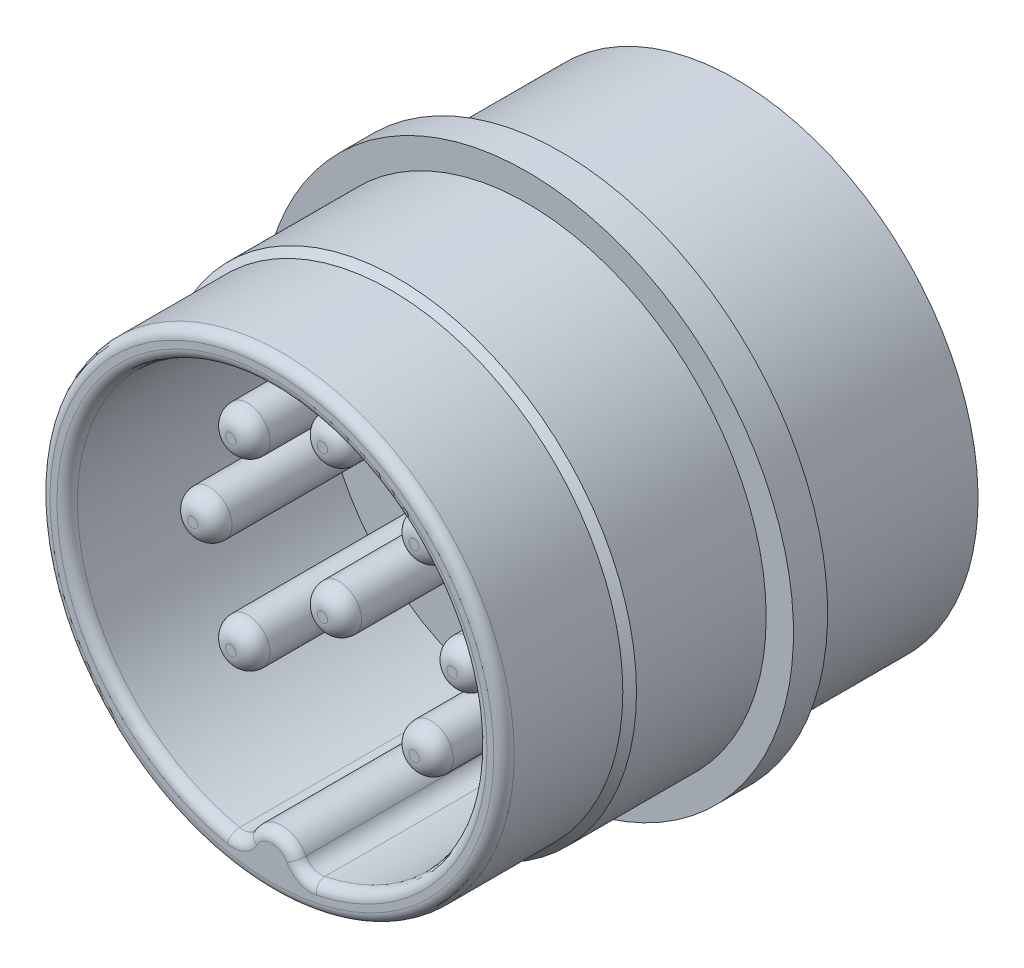
from build123d import *

# Parameters (mm, degrees)
SKETCH1_W           = 9.906
SKETCH1_H           = 1.27
SKETCH2_R           = 9
BOSS_EXTRUDE1_DEPTH = 6.5024
SKETCH3_R           = 8.89
BOSS_EXTRUDE2_DEPTH = 4.826
SKETCH4_R           = 8.89
BOSS_EXTRUDE3_DEPTH = 0.254
BOSS_EXTRUDE3_TAPER = 45
SKETCH5_R           = 8.636
BOSS_EXTRUDE4_DEPTH = 4.4196
CUT_EXTRUDE1_DEPTH  = 9.4996
SKETCH7_W           = 0.8255
SKETCH7_H           = 7.62
SKETCH8_W           = 0.8255
SKETCH8_H           = 7.62
SKETCH9_W           = 0.8255
SKETCH9_H           = 7.62
SKETCH10_W          = 0.8255
SKETCH10_H          = 7.62
SKETCH11_W          = 0.8255
SKETCH11_H          = 7.62
SKETCH12_W          = 0.8255
SKETCH12_H          = 7.62
SKETCH13_W          = 0.8255
SKETCH13_H          = 7.62
SKETCH14_W          = 0.8255
SKETCH14_H          = 7.62
RIB1_START          = -1.27
RIB1_OUTLINE_W      = 2.779
RIB1_OUTLINE_H      = 1.016
RIB1_DEPTH          = 2.54
FILLET1_R           = 0.0254
FILLET2_R           = 0.635
FILLET3_R           = 0.381


# Read off the part's stored shape, not the designer's step: Rib1
with BuildPart() as part:
    # Sketch1 → Revolve1 (revolve)
    with BuildSketch(Plane.XZ, mode=Mode.PRIVATE) as revolve1_sk:
        with Locations((4.953, -0.635)):
            Rectangle(SKETCH1_W, SKETCH1_H)
    revolve(revolve1_sk.sketch.rotate(Axis((0, 0, 0), (0, 0, -1)), 180), axis=Axis((0, 0, 0), (0, 0, -1)))

    # Sketch2 → Boss-Extrude1 (add)
    with BuildSketch(Plane(origin=(0, 0, -1.27), x_dir=(-1, 0, 0), z_dir=(0, 0, -1))):
        Circle(SKETCH2_R)
    extrude(amount=BOSS_EXTRUDE1_DEPTH)

    # Sketch3 → Boss-Extrude2 (add)
    with BuildSketch(Plane.XY):
        Circle(SKETCH3_R)
    extrude(amount=BOSS_EXTRUDE2_DEPTH)

    # Sketch4 → Boss-Extrude3 (add)
    with BuildSketch(Plane.XY.offset(4.826)):
        Circle(SKETCH4_R)
    extrude(amount=BOSS_EXTRUDE3_DEPTH, taper=BOSS_EXTRUDE3_TAPER)

    # Sketch5 → Boss-Extrude4 (add)
    with BuildSketch(Plane.XY.offset(5.08)):
        Circle(SKETCH5_R)
    extrude(amount=BOSS_EXTRUDE4_DEPTH)

    # Sketch6 → Cut-Extrude1 (cut)
    with BuildSketch(Plane.XY.offset(9.4996)):
        with BuildLine():
            ThreePointArc((-1.013739708, -7.552266667), (0, -6.604), (1.013739708, -7.552266667))
            ThreePointArc((1.013739708, -7.552266667), (0, 7.62), (-1.013739708, -7.552266667))
        make_face()
    extrude(amount=-CUT_EXTRUDE1_DEPTH, mode=Mode.SUBTRACT)

    # Sketch7 → Revolve2 (revolve)
    with BuildSketch(Plane(origin=(0, 0, 0), x_dir=(1, 0, 0), z_dir=(0, 1, 0))):
        with Locations((-4.41325, -3.81)):
            Rectangle(SKETCH7_W, SKETCH7_H)
    revolve(axis=Axis((-4.826, 0, 0), (0, 0, 1)))

    # Sketch8 → Revolve3 (revolve)
    with BuildSketch(Plane(origin=(0, 3.412497326, 0), x_dir=(1, 0, 0), z_dir=(0, 1, 0))):
        with Locations((-2.999747326, -3.81)):
            Rectangle(SKETCH8_W, SKETCH8_H)
    revolve(axis=Axis((-3.412497326, 3.412497326, 0), (0, 0, 1)))

    # Sketch9 → Revolve4 (revolve)
    with BuildSketch(Plane(origin=(0, -3.412497326, 0), x_dir=(1, 0, 0), z_dir=(0, 1, 0))):
        with Locations((-2.999747326, -3.81)):
            Rectangle(SKETCH9_W, SKETCH9_H)
    revolve(axis=Axis((-3.412497326, -3.412497326, 0), (0, 0, 1)))

    # Sketch10 → Revolve5 (revolve)
    with BuildSketch(Plane(origin=(0, -3.412497326, 0), x_dir=(1, 0, 0), z_dir=(0, 1, 0))):
        with Locations((3.825247326, -3.81)):
            Rectangle(SKETCH10_W, SKETCH10_H)
    revolve(axis=Axis((3.412497326, -3.412497326, 0), (0, 0, 1)))

    # Sketch11 → Revolve6 (revolve)
    with BuildSketch(Plane(origin=(0, 0, 0), x_dir=(1, 0, 0), z_dir=(0, 1, 0))):
        with Locations((5.23875, -3.81)):
            Rectangle(SKETCH11_W, SKETCH11_H)
    revolve(axis=Axis((4.826, 0, 0), (0, 0, 1)))

    # Sketch12 → Revolve7 (revolve)
    with BuildSketch(Plane(origin=(0, 4.826, 0), x_dir=(1, 0, 0), z_dir=(0, 1, 0))):
        with Locations((0.41275, -3.81)):
            Rectangle(SKETCH12_W, SKETCH12_H)
    revolve(axis=Axis((0, 4.826, 0), (0, 0, 1)))

    # Sketch13 → Revolve8 (revolve)
    with BuildSketch(Plane(origin=(0, 3.412497326, 0), x_dir=(1, 0, 0), z_dir=(0, 1, 0))):
        with Locations((3.825247326, -3.81)):
            Rectangle(SKETCH13_W, SKETCH13_H)
    revolve(axis=Axis((3.412497326, 3.412497326, 0), (0, 0, 1)))

    # Sketch14 → Revolve9 (revolve)
    with BuildSketch(Plane(origin=(0, -0.635, 0), x_dir=(1, 0, 0), z_dir=(0, 1, 0))):
        with Locations((0.41275, -3.81)):
            Rectangle(SKETCH14_W, SKETCH14_H)
    revolve(axis=Axis((0, -0.635, 0), (0, 0, 1)))

    # Rib1 outline → Rib1 (add)
    with BuildSketch(Plane(origin=(0, 0, 0), x_dir=(0, -1, 0), z_dir=(-1, 0, 0)).offset(RIB1_START)):
        with Locations((8.3895, -1.778)):
            Rectangle(RIB1_OUTLINE_W, RIB1_OUTLINE_H)
    extrude(amount=RIB1_DEPTH)

    # Fillet1
    fillet1_edges = [part.edges().sort_by_distance(p)[0] for p in [
        (0, -9.779, -1.27),
        (1.27, -9.344471942, -1.27),
        (1.27, -9.779, -1.778),
        (-1.27, -9.779, -1.778),
        (-1.27, -9.344471942, -1.27),
    ]]
    fillet(fillet1_edges, radius=FILLET1_R)

    # Fillet2
    fillet2_edges = [part.edges().sort_by_distance(p)[0] for p in [
        (-1.013739708, -7.552266667, 4.7498),
        (1.013739708, -7.552266667, 4.7498),
        (-5.6515, 0, 7.62),
        (-4.237997326, 3.412497326, 7.62),
        (-4.237997326, -3.412497326, 7.62),
        (2.586997326, -3.412497326, 7.62),
        (4.0005, 0, 7.62),
        (-0.8255, 4.826, 7.62),
        (2.586997326, 3.412497326, 7.62),
        (-0.8255, -0.635, 7.62),
    ]]
    fillet(fillet2_edges, radius=FILLET2_R)

    # Fillet3
    fillet3_edges = [part.edges().sort_by_distance(p)[0] for p in [
        (0, 7.62, 9.4996),
        (0, -6.604, 9.4996),
        (1.185164537, -7.409213372, 9.4996),
        (-1.185164537, -7.409213372, 9.4996),
        (-8.636, 0, 9.4996),
    ]]
    fillet(fillet3_edges, radius=FILLET3_R)


solid = part.part
